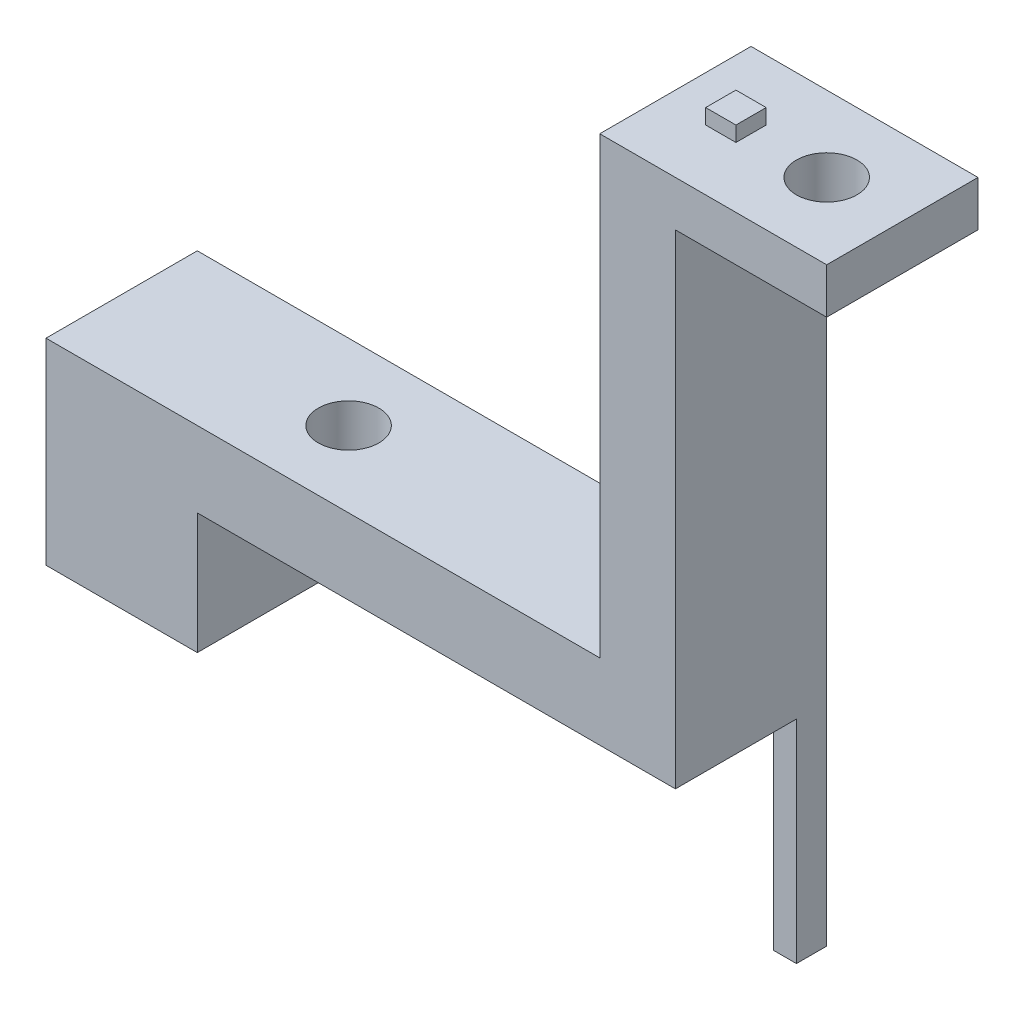
from build123d import *

# Parameters (mm, degrees)
BOSS_EXTRUDE1_DEPTH = 10
SKETCH2_W           = 5.1
SKETCH2_H           = 3.1
CUT_EXTRUDE1_DEPTH  = 10
SKETCH3_W           = 2
SKETCH3_H           = 2
BOSS_EXTRUDE2_DEPTH = 1
CUT_EXTRUDE4_REACH  = 69.908
SKETCH11_R          = 2
SKETCH12_W          = 1.5
SKETCH12_H          = 2
BOSS_EXTRUDE4_DEPTH = 14
SKETCH13_R          = 2
CUT_EXTRUDE6_DEPTH  = 3


with BuildPart() as part:
    # Sketch1 → Boss-Extrude1 (new body)
    with BuildSketch(Plane.XY):
        Polygon((10, 13), (36.6, 13), (36.6, 43), (51.6, 43), (51.6, 40), (41.6, 40), (41.6, 8), (10, 8), (10, 0), (0, 0), (0, 13), align=None)
    extrude(amount=BOSS_EXTRUDE1_DEPTH)

    # Sketch2 → Cut-Extrude1 (cut)
    with BuildSketch(Plane.XZ):
        with Locations((5, 5)):
            Rectangle(SKETCH2_W, SKETCH2_H)
    extrude(amount=-CUT_EXTRUDE1_DEPTH, mode=Mode.SUBTRACT)

    # Sketch3 → Boss-Extrude2 (add)
    with BuildSketch(Plane(origin=(0, 43, 0), x_dir=(1, 0, 0), z_dir=(0, 1, 0))):
        with Locations((40.6, -5)):
            Rectangle(SKETCH3_W, SKETCH3_H)
    extrude(amount=BOSS_EXTRUDE2_DEPTH)

    # Sketch11 → Cut-Extrude4 (cut, up to next)
    with BuildSketch(Plane(origin=(0, 43, 0), x_dir=(1, 0, 0), z_dir=(0, 1, 0)), mode=Mode.PRIVATE) as cut_extrude4_sk1:
        with Locations((46.6, -5)):
            Circle(SKETCH11_R)
    cut_extrude4_tool1 = extrude(cut_extrude4_sk1.sketch, amount=-CUT_EXTRUDE4_REACH, mode=Mode.PRIVATE) & part.part
    add(cut_extrude4_tool1.solids().sort_by_distance((46.6, 43, 5))[0], mode=Mode.SUBTRACT)

    # Sketch12 → Boss-Extrude4 (add)
    with BuildSketch(Plane.XZ.offset(-8)):
        with Locations((40.85, 1)):
            Rectangle(SKETCH12_W, SKETCH12_H)
    extrude(amount=BOSS_EXTRUDE4_DEPTH)

    # Sketch13 → Cut-Extrude6 (cut)
    with BuildSketch(Plane(origin=(0, 13, 0), x_dir=(1, 0, 0), z_dir=(0, 1, 0))):
        with Locations((15, -5)):
            Circle(SKETCH13_R)
    extrude(amount=-CUT_EXTRUDE6_DEPTH, mode=Mode.SUBTRACT)


solid = part.part
